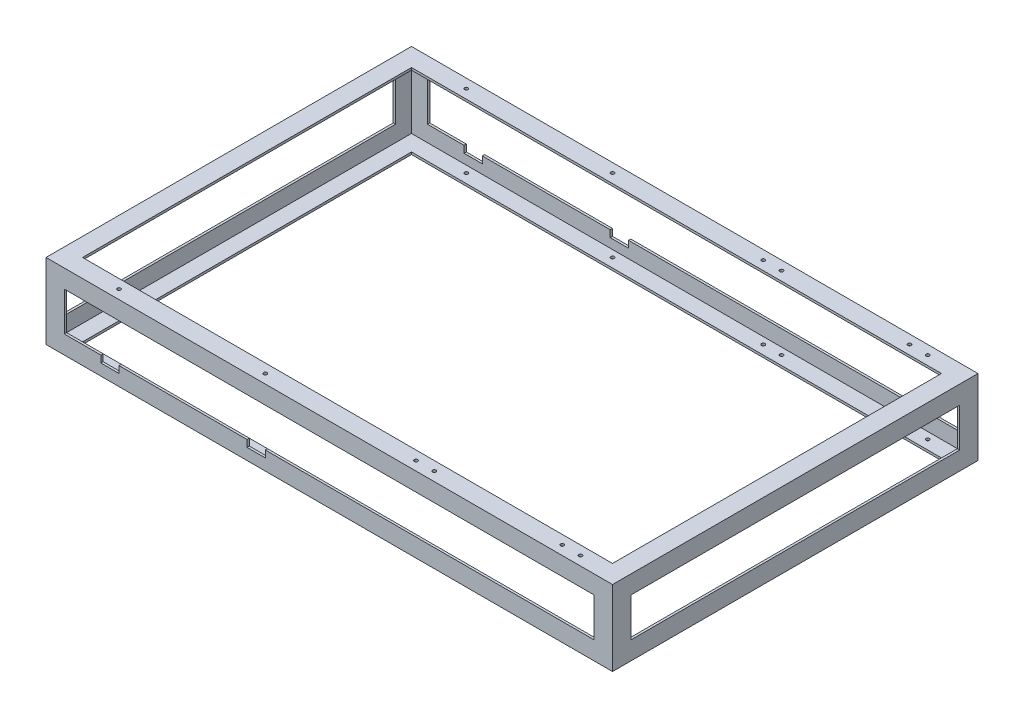
from build123d import *

# Parameters (mm, degrees)
X_ANGLE_LENTH_DEPTH             = 1574.8
X_ANGLE_LENTH_2_DEPTH           = 1574.8
X_ANGLE_LENTH_3_DEPTH           = 1574.8
X_ANGLE_LENTH_4_DEPTH           = 1574.8
Y_ANGLE_LENTH_DEPTH             = 209.55
Z_ANGLE_LENTH_REACH             = 1684.546
Z_ANGLE_LENTH_DIRECTION_2_REACH = 1684.546
SKETCH16_R                      = 4.7625
WHEEL_MOUNT_LOC_HOLES_DEPTH     = 1668.923931869
SKETCH17_W                      = 50.8
SKETCH17_H                      = 38.1
FRONT_CONTROL_ARM_CUTOUTS_DEPTH = 1899.724329649


with BuildPart() as part:
    # Sketch5 → X Angle Lenth (new body)
    with BuildSketch(Plane(origin=(0, 0, 0), x_dir=(0, 0, -1), z_dir=(1, 0, 0))):
        Polygon((-508, -304.8), (-508, -254), (-501.65, -254), (-501.65, -298.45), (-457.2, -298.45), (-457.2, -304.8), align=None)
    extrude(amount=X_ANGLE_LENTH_DEPTH)



with BuildPart() as body_2:
    # Sketch5 → X Angle Lenth 2 (new body)
    with BuildSketch(Plane(origin=(0, 0, 0), x_dir=(0, 0, -1), z_dir=(1, 0, 0))):
        Polygon((501.65, -254), (508, -254), (508, -304.8), (457.2, -304.8), (457.2, -298.45), (501.65, -298.45), align=None)
    extrude(amount=X_ANGLE_LENTH_2_DEPTH)


with BuildPart() as body_3:
    # Sketch5 → X Angle Lenth 3 (new body)
    with BuildSketch(Plane(origin=(0, 0, 0), x_dir=(0, 0, -1), z_dir=(1, 0, 0))):
        Polygon((508, -95.25), (508, -146.05), (501.65, -146.05), (501.65, -101.6), (457.2, -101.6), (457.2, -95.25), align=None)
    extrude(amount=X_ANGLE_LENTH_3_DEPTH)


with BuildPart() as body_4:
    # Sketch5 → X Angle Lenth 4 (new body)
    with BuildSketch(Plane(origin=(0, 0, 0), x_dir=(0, 0, -1), z_dir=(1, 0, 0))):
        Polygon((-501.65, -146.05), (-508, -146.05), (-508, -95.25), (-457.2, -95.25), (-457.2, -101.6), (-501.65, -101.6), align=None)
    extrude(amount=X_ANGLE_LENTH_4_DEPTH)


with BuildPart() as part_1:
    add(part.part)

    add(body_2.part)  # Y Angle Lenth merges body 2

    add(body_3.part)  # Y Angle Lenth merges body 3

    add(body_4.part)  # Y Angle Lenth merges body 4
    # Sketch6 → Y Angle Lenth (add)
    with BuildSketch(Plane.XZ.offset(304.8)):
        Polygon((1574.8, -508), (1524, -508), (1524, -501.65), (1568.45, -501.65), (1568.45, -457.2), (1574.8, -457.2), align=None)
        Polygon((1524, 501.65), (1524, 508), (1574.8, 508), (1574.8, 457.2), (1568.45, 457.2), (1568.45, 501.65), align=None)
        Polygon((0, 508), (50.8, 508), (50.8, 501.65), (6.35, 501.65), (6.35, 457.2), (0, 457.2), align=None)
        Polygon((50.8, -501.65), (50.8, -508), (0, -508), (0, -457.2), (6.35, -457.2), (6.35, -501.65), align=None)
    extrude(amount=-Y_ANGLE_LENTH_DEPTH)

    # Sketch15 → Z Angle Lenth (add, up to next)
    with BuildSketch(Plane.XY, mode=Mode.PRIVATE) as z_angle_lenth_sk1:
        Polygon((0, -254), (0, -304.8), (50.8, -304.8), (50.8, -298.45), (6.35, -298.45), (6.35, -254), align=None)
    z_angle_lenth_tool1 = extrude(z_angle_lenth_sk1.sketch, amount=-Z_ANGLE_LENTH_REACH, mode=Mode.PRIVATE) - part_1.part
    # Sketch15 → Z Angle Lenth (add, up to next)
    with BuildSketch(Plane.XY, mode=Mode.PRIVATE) as z_angle_lenth_sk2:
        Polygon((1568.45, -254), (1574.8, -254), (1574.8, -304.8), (1524, -304.8), (1524, -298.45), (1568.45, -298.45), align=None)
    z_angle_lenth_tool2 = extrude(z_angle_lenth_sk2.sketch, amount=-Z_ANGLE_LENTH_REACH, mode=Mode.PRIVATE) - part_1.part
    # Sketch15 → Z Angle Lenth (add, up to next)
    with BuildSketch(Plane.XY, mode=Mode.PRIVATE) as z_angle_lenth_sk3:
        Polygon((1574.8, -146.05), (1574.8, -95.25), (1524, -95.25), (1524, -101.6), (1568.45, -101.6), (1568.45, -146.05), align=None)
    z_angle_lenth_tool3 = extrude(z_angle_lenth_sk3.sketch, amount=-Z_ANGLE_LENTH_REACH, mode=Mode.PRIVATE) - part_1.part
    # Sketch15 → Z Angle Lenth (add, up to next)
    with BuildSketch(Plane.XY, mode=Mode.PRIVATE) as z_angle_lenth_sk4:
        Polygon((6.35, -146.05), (0, -146.05), (0, -95.25), (50.8, -95.25), (50.8, -101.6), (6.35, -101.6), align=None)
    z_angle_lenth_tool4 = extrude(z_angle_lenth_sk4.sketch, amount=-Z_ANGLE_LENTH_REACH, mode=Mode.PRIVATE) - part_1.part
    add(z_angle_lenth_tool1.solids().sort_by_distance((0.71842, -279.4, 0))[0])
    add(z_angle_lenth_tool2.solids().sort_by_distance((1571.625, -254.71842, 0))[0])
    add(z_angle_lenth_tool3.solids().sort_by_distance((1574.08158, -120.65, 0))[0])
    add(z_angle_lenth_tool4.solids().sort_by_distance((3.175, -145.33158, 0))[0])

    # Sketch15 → Z Angle Lenth direction 2 (add, up to next)
    with BuildSketch(Plane.XY, mode=Mode.PRIVATE) as z_angle_lenth_direction_2_sk1:
        Polygon((0, -254), (0, -304.8), (50.8, -304.8), (50.8, -298.45), (6.35, -298.45), (6.35, -254), align=None)
    z_angle_lenth_direction_2_tool1 = extrude(z_angle_lenth_direction_2_sk1.sketch, amount=Z_ANGLE_LENTH_DIRECTION_2_REACH, mode=Mode.PRIVATE) - part_1.part
    # Sketch15 → Z Angle Lenth direction 2 (add, up to next)
    with BuildSketch(Plane.XY, mode=Mode.PRIVATE) as z_angle_lenth_direction_2_sk2:
        Polygon((1568.45, -254), (1574.8, -254), (1574.8, -304.8), (1524, -304.8), (1524, -298.45), (1568.45, -298.45), align=None)
    z_angle_lenth_direction_2_tool2 = extrude(z_angle_lenth_direction_2_sk2.sketch, amount=Z_ANGLE_LENTH_DIRECTION_2_REACH, mode=Mode.PRIVATE) - part_1.part
    # Sketch15 → Z Angle Lenth direction 2 (add, up to next)
    with BuildSketch(Plane.XY, mode=Mode.PRIVATE) as z_angle_lenth_direction_2_sk3:
        Polygon((1574.8, -146.05), (1574.8, -95.25), (1524, -95.25), (1524, -101.6), (1568.45, -101.6), (1568.45, -146.05), align=None)
    z_angle_lenth_direction_2_tool3 = extrude(z_angle_lenth_direction_2_sk3.sketch, amount=Z_ANGLE_LENTH_DIRECTION_2_REACH, mode=Mode.PRIVATE) - part_1.part
    # Sketch15 → Z Angle Lenth direction 2 (add, up to next)
    with BuildSketch(Plane.XY, mode=Mode.PRIVATE) as z_angle_lenth_direction_2_sk4:
        Polygon((6.35, -146.05), (0, -146.05), (0, -95.25), (50.8, -95.25), (50.8, -101.6), (6.35, -101.6), align=None)
    z_angle_lenth_direction_2_tool4 = extrude(z_angle_lenth_direction_2_sk4.sketch, amount=Z_ANGLE_LENTH_DIRECTION_2_REACH, mode=Mode.PRIVATE) - part_1.part
    add(z_angle_lenth_direction_2_tool1.solids().sort_by_distance((0.71842, -279.4, 0))[0])
    add(z_angle_lenth_direction_2_tool2.solids().sort_by_distance((1571.625, -254.71842, 0))[0])
    add(z_angle_lenth_direction_2_tool3.solids().sort_by_distance((1574.08158, -120.65, 0))[0])
    add(z_angle_lenth_direction_2_tool4.solids().sort_by_distance((3.175, -145.33158, 0))[0])

    # Sketch16 → Wheel Mount LOC Holes (cut, through all)
    with BuildSketch(Plane(origin=(0, -95.25, 0), x_dir=(1, 0, 0), z_dir=(0, 1, 0))):
        with Locations((1409.7, 482.6)):
            Circle(SKETCH16_R)
        with Locations((1003.3, 482.6)):
            Circle(SKETCH16_R)
        with Locations((584.2, 482.6)):
            Circle(SKETCH16_R)
        with Locations((177.8, 482.6)):
            Circle(SKETCH16_R)
        with Locations((177.8, -482.6)):
            Circle(SKETCH16_R)
        with Locations((584.2, -482.6)):
            Circle(SKETCH16_R)
        with Locations((1003.3, -482.6)):
            Circle(SKETCH16_R)
        with Locations((1409.7, -482.6)):
            Circle(SKETCH16_R)
        with Locations((1054.1, 482.6)):
            Circle(SKETCH16_R)
        with Locations((1460.5, 482.6)):
            Circle(SKETCH16_R)
        with Locations((1460.5, -482.6)):
            Circle(SKETCH16_R)
        with Locations((1054.1, -482.6)):
            Circle(SKETCH16_R)
    extrude(amount=-WHEEL_MOUNT_LOC_HOLES_DEPTH, mode=Mode.SUBTRACT)

    # Sketch17 → Front Control Arm Cutouts (cut, through all)
    with BuildSketch(Plane.XY.offset(508)):
        with Locations((177.8, -254)):
            Rectangle(SKETCH17_W, SKETCH17_H)
        with Locations((584.2, -254)):
            Rectangle(SKETCH17_W, SKETCH17_H)
    extrude(amount=-FRONT_CONTROL_ARM_CUTOUTS_DEPTH, mode=Mode.SUBTRACT)


solid = part_1.part
